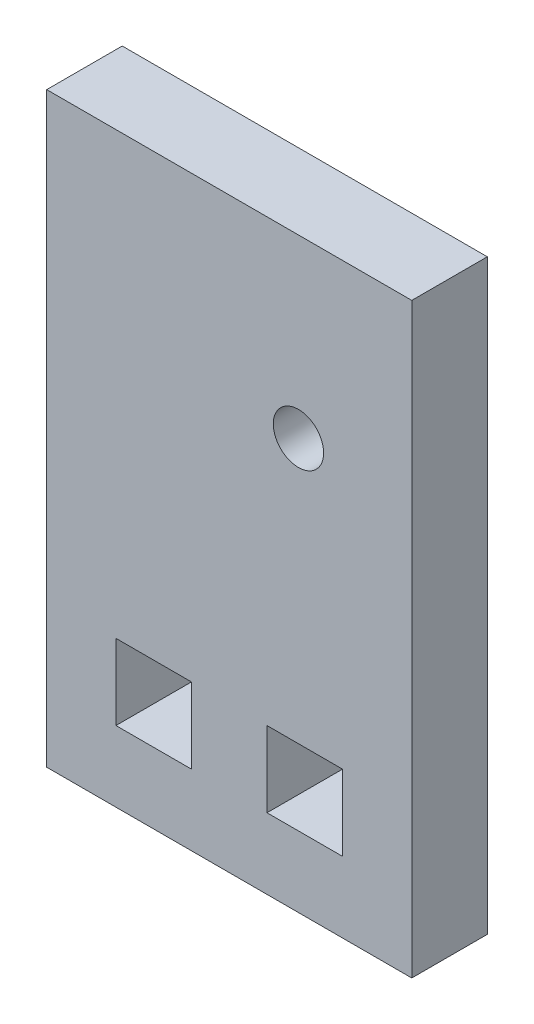
from build123d import *

# Parameters (mm, degrees)
SKETCH2_R           = 1
SKETCH2_W           = 3
SKETCH2_H           = 3
BOSS_EXTRUDE1_DEPTH = 3


with BuildPart() as part:
    # Sketch2 → Boss-Extrude1 (new body)
    with BuildSketch(Plane.XY):
        Polygon((-7.004815981, -7.307896607), (-7.004815981, 13.192103393), (7.495184019, 13.192103393), (7.495184019, -7.116996403), (7.495184019, -10.116996403), (-7.004815981, -10.116996403), align=None)
        with Locations((2.995184019, 6.192103393)):
            Circle(SKETCH2_R, mode=Mode.SUBTRACT)
        with Locations((-2.754815981, -5.807896607)):
            Rectangle(SKETCH2_W, SKETCH2_H, mode=Mode.SUBTRACT)
        with Locations((3.245184019, -5.807896607)):
            Rectangle(SKETCH2_W, SKETCH2_H, mode=Mode.SUBTRACT)
    extrude(amount=BOSS_EXTRUDE1_DEPTH)


solid = part.part
